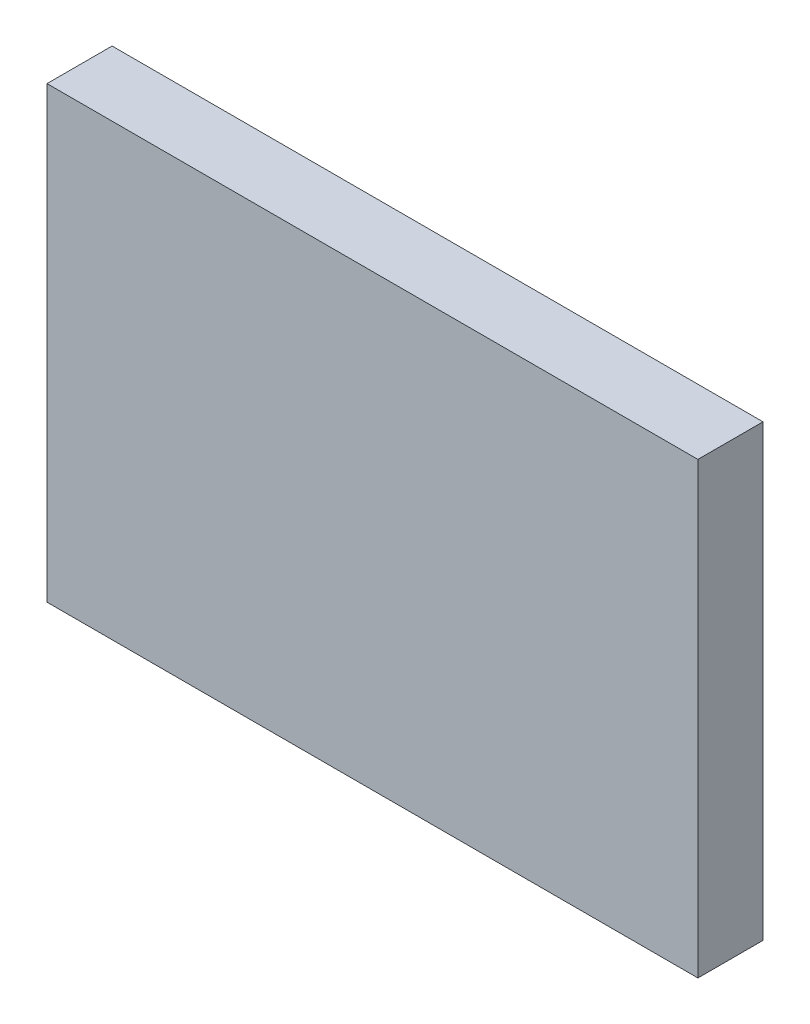
from build123d import *

# Parameters (mm, degrees)
SKETCH_1_W      = 100
SKETCH_1_H      = 69
EXTRUDE_1_DEPTH = 10


with BuildPart() as part:
    # 草图1 → 凸台-拉伸1 (new body)
    with BuildSketch(Plane.XY):
        Rectangle(SKETCH_1_W, SKETCH_1_H)
    extrude(amount=EXTRUDE_1_DEPTH)


solid = part.part
